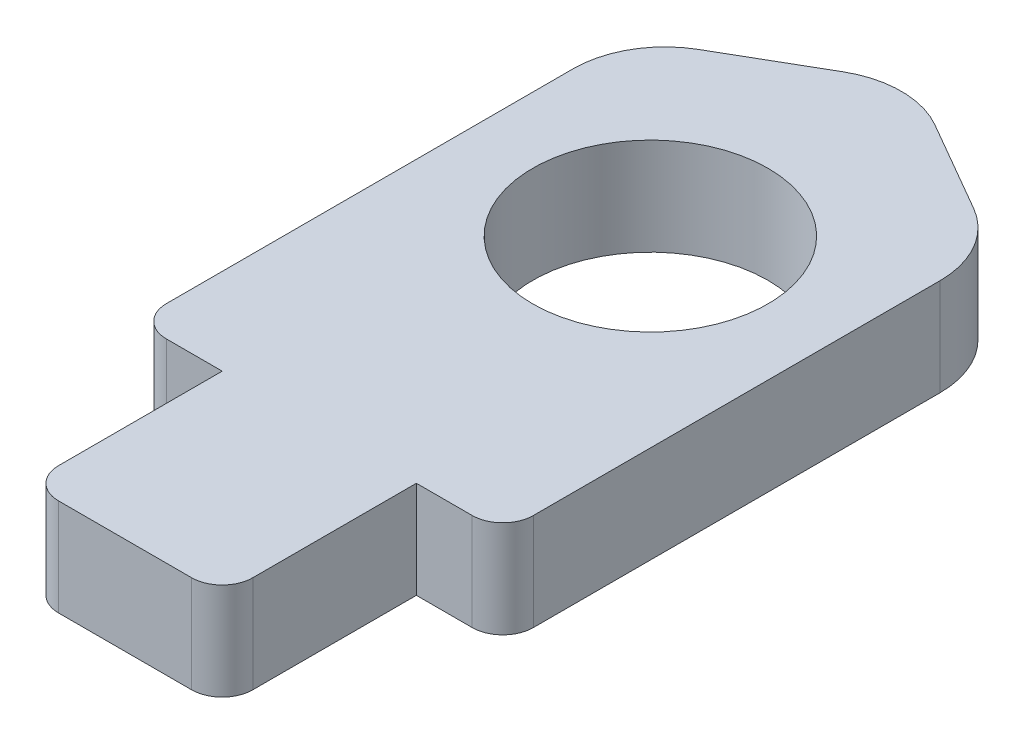
from build123d import *

# Parameters (mm, degrees)
SKETCH2_R                 = 3.845
MOTORMOUNT_EXTRUDE_DEPTH  = 3.175
MOTORMOUNT_CORNERFILLET_R = 1


with BuildPart() as part:
    # Sketch2 → MotorMount_Extrude (new body)
    with BuildSketch(Plane(origin=(0, 0, 0), x_dir=(1, 0, 0), z_dir=(0, 1, 0))):
        with BuildLine():
            ThreePointArc((-5.449489743, 5.205), (-5.859061842, 4.381665532), (-6, 3.472949192))
            Line((-6, 3.472949192), (-6, -10.8257274))
            Line((-6, -10.8257274), (-3.175, -10.8257274))
            Line((-3.175, -10.8257274), (-3.175, -17.1757274))
            Line((-3.175, -17.1757274), (3.175, -17.1757274))
            Line((3.175, -17.1757274), (3.175, -10.8257274))
            Line((3.175, -10.8257274), (6, -10.8257274))
            Line((6, -10.8257274), (6, 3.472949192))
            ThreePointArc((6, 3.472949192), (5.859061842, 4.381665532), (5.449489743, 5.205))
            ThreePointArc((5.449489743, 5.205), (5.021662016, 5.689451548), (4.5, 6.071025404))
            Line((4.5, 6.071025404), (1.5, 7.803076211))
            ThreePointArc((1.5, 7.803076211), (0, 8.205), (-1.5, 7.803076211))
            Line((-1.5, 7.803076211), (-4.5, 6.071025404))
            ThreePointArc((-4.5, 6.071025404), (-5.021662016, 5.689451548), (-5.449489743, 5.205))
        make_face()
        Circle(SKETCH2_R, mode=Mode.SUBTRACT)
    extrude(amount=MOTORMOUNT_EXTRUDE_DEPTH)

    # MotorMount_CornerFillet
    motormount_cornerfillet_edges = [part.edges().sort_by_distance(p)[0] for p in [
        (6, 1.5875, 10.8257274),
        (-6, 1.5875, 10.8257274),
        (-3.175, 1.5875, 17.1757274),
        (3.175, 1.5875, 17.1757274),
    ]]
    fillet(motormount_cornerfillet_edges, radius=MOTORMOUNT_CORNERFILLET_R)


solid = part.part
